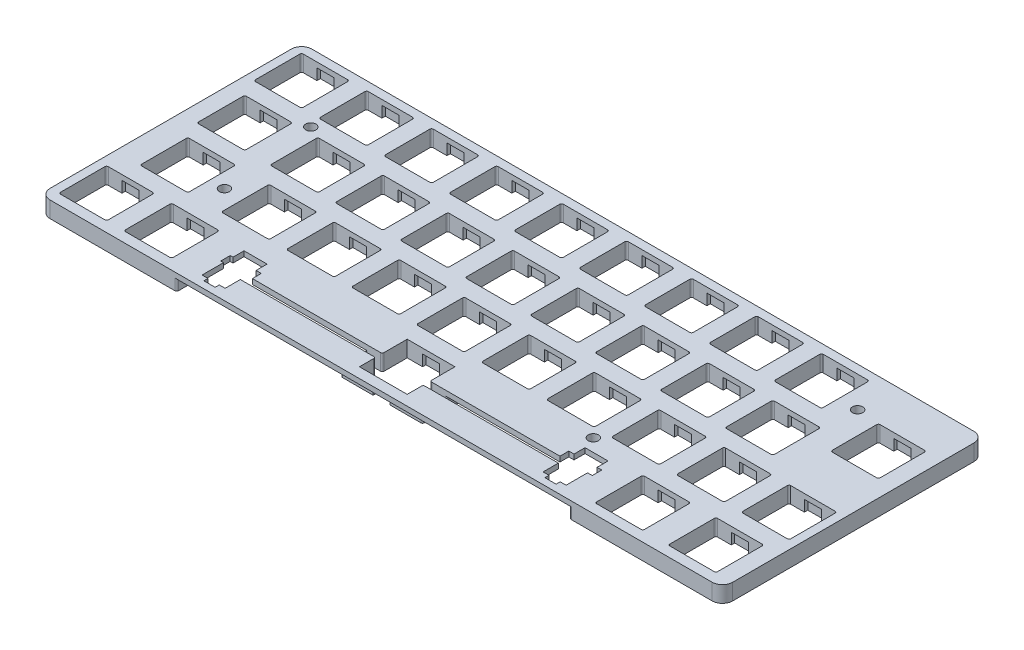
from build123d import *

# Parameters (mm, degrees)
SKETCH1_W           = 200.025
SKETCH1_H           = 76.675
BOSS_EXTRUDE1_DEPTH = 4.75
FILLET1_R           = 3
CUT_EXTRUDE1_DEPTH  = 3.25
FILLET2_R           = 0.5
CUT_EXTRUDE2_START  = -1.5
SKETCH5_W           = 5
SKETCH5_H           = 16
CUT_EXTRUDE2_DEPTH  = 3.25
SKETCH6_R           = 1.5
CUT_EXTRUDE3_DEPTH  = 211.847855396


with BuildPart() as part:
    # Sketch1 → Boss-Extrude1 (new body)
    with BuildSketch(Plane(origin=(0, 0, 0), x_dir=(1, 0, 0), z_dir=(0, 1, 0))):
        with Locations((97.4875, 35.3375)):
            Rectangle(SKETCH1_W, SKETCH1_H)
        with BuildLine():
            Line((13.5, 0), (0.5, 0))
            ThreePointArc((0.5, 0), (0.146446609, 0.146446609), (0, 0.5))
            Line((0, 0.5), (0, 13.5))
            ThreePointArc((0, 13.5), (0.146446609, 13.853553391), (0.5, 14))
            Line((0.5, 14), (13.5, 14))
            ThreePointArc((13.5, 14), (13.853553391, 13.853553391), (14, 13.5))
            Line((14, 13.5), (14, 0.5))
            ThreePointArc((14, 0.5), (13.853553391, 0.146446609), (13.5, 0))
        make_face(mode=Mode.SUBTRACT)
        with BuildLine():
            Line((32.55, 0), (19.55, 0))
            ThreePointArc((19.55, 0), (19.196446609, 0.146446609), (19.05, 0.5))
            Line((19.05, 0.5), (19.05, 13.5))
            ThreePointArc((19.05, 13.5), (19.196446609, 13.853553391), (19.55, 14))
            Line((19.55, 14), (32.55, 14))
            ThreePointArc((32.55, 14), (32.903553391, 13.853553391), (33.05, 13.5))
            Line((33.05, 13.5), (33.05, 0.5))
            ThreePointArc((33.05, 0.5), (32.903553391, 0.146446609), (32.55, 0))
        make_face(mode=Mode.SUBTRACT)
        Polygon((102.10625, 14), (102.10625, 6.7), (140.18125, 6.7), (140.18125, 9.3), (141.70625, 9.3), (141.70625, 12.53), (148.45625, 12.53), (148.45625, 9.3), (149.837752958, 9.3), (149.837752958, 6.515), (148.45625, 6.515), (148.45625, 0.23), (146.73125, 0.23), (146.73125, -0.97), (143.43125, -0.97), (143.43125, 0.23), (141.70625, 0.23), (141.70625, 4.7), (102.10625, 4.7), (102.10625, 0), (88.10625, 0), (88.10625, 4.7), (48.50625, 4.7), (48.50625, 0.23), (46.78125, 0.23), (46.78125, -0.97), (43.48125, -0.97), (43.48125, 0.23), (41.75625, 0.23), (41.75625, 6.515), (40.93125, 6.515), (40.93125, 9.3), (41.75625, 9.3), (41.75625, 12.53), (48.50625, 12.53), (48.50625, 9.3), (50.03125, 9.3), (50.03125, 6.7), (88.10625, 6.7), (88.10625, 14), align=None, mode=Mode.SUBTRACT)
        with BuildLine():
            Line((18.2625, 19.05), (5.2625, 19.05))
            ThreePointArc((5.2625, 19.05), (4.908946609, 19.196446609), (4.7625, 19.55))
            Line((4.7625, 19.55), (4.7625, 32.55))
            ThreePointArc((4.7625, 32.55), (4.908946609, 32.903553391), (5.2625, 33.05))
            Line((5.2625, 33.05), (18.2625, 33.05))
            ThreePointArc((18.2625, 33.05), (18.616053391, 32.903553391), (18.7625, 32.55))
            Line((18.7625, 32.55), (18.7625, 19.55))
            ThreePointArc((18.7625, 19.55), (18.616053391, 19.196446609), (18.2625, 19.05))
        make_face(mode=Mode.SUBTRACT)
        with BuildLine():
            Line((42.075, 19.05), (29.075, 19.05))
            ThreePointArc((29.075, 19.05), (28.721446609, 19.196446609), (28.575, 19.55))
            Line((28.575, 19.55), (28.575, 32.55))
            ThreePointArc((28.575, 32.55), (28.721446609, 32.903553391), (29.075, 33.05))
            Line((29.075, 33.05), (42.075, 33.05))
            ThreePointArc((42.075, 33.05), (42.428553391, 32.903553391), (42.575, 32.55))
            Line((42.575, 32.55), (42.575, 19.55))
            ThreePointArc((42.575, 19.55), (42.428553391, 19.196446609), (42.075, 19.05))
        make_face(mode=Mode.SUBTRACT)
        with BuildLine():
            Line((61.125, 19.05), (48.125, 19.05))
            ThreePointArc((48.125, 19.05), (47.771446609, 19.196446609), (47.625, 19.55))
            Line((47.625, 19.55), (47.625, 32.55))
            ThreePointArc((47.625, 32.55), (47.771446609, 32.903553391), (48.125, 33.05))
            Line((48.125, 33.05), (61.125, 33.05))
            ThreePointArc((61.125, 33.05), (61.478553391, 32.903553391), (61.625, 32.55))
            Line((61.625, 32.55), (61.625, 19.55))
            ThreePointArc((61.625, 19.55), (61.478553391, 19.196446609), (61.125, 19.05))
        make_face(mode=Mode.SUBTRACT)
        with BuildLine():
            Line((80.175, 19.05), (67.175, 19.05))
            ThreePointArc((67.175, 19.05), (66.821446609, 19.196446609), (66.675, 19.55))
            Line((66.675, 19.55), (66.675, 32.55))
            ThreePointArc((66.675, 32.55), (66.821446609, 32.903553391), (67.175, 33.05))
            Line((67.175, 33.05), (80.175, 33.05))
            ThreePointArc((80.175, 33.05), (80.528553391, 32.903553391), (80.675, 32.55))
            Line((80.675, 32.55), (80.675, 19.55))
            ThreePointArc((80.675, 19.55), (80.528553391, 19.196446609), (80.175, 19.05))
        make_face(mode=Mode.SUBTRACT)
        with BuildLine():
            Line((99.225, 19.05), (86.225, 19.05))
            ThreePointArc((86.225, 19.05), (85.871446609, 19.196446609), (85.725, 19.55))
            Line((85.725, 19.55), (85.725, 32.55))
            ThreePointArc((85.725, 32.55), (85.871446609, 32.903553391), (86.225, 33.05))
            Line((86.225, 33.05), (99.225, 33.05))
            ThreePointArc((99.225, 33.05), (99.578553391, 32.903553391), (99.725, 32.55))
            Line((99.725, 32.55), (99.725, 19.55))
            ThreePointArc((99.725, 19.55), (99.578553391, 19.196446609), (99.225, 19.05))
        make_face(mode=Mode.SUBTRACT)
        with BuildLine():
            Line((170.6625, 0), (157.6625, 0))
            ThreePointArc((157.6625, 0), (157.308946609, 0.146446609), (157.1625, 0.5))
            Line((157.1625, 0.5), (157.1625, 13.5))
            ThreePointArc((157.1625, 13.5), (157.308946609, 13.853553391), (157.6625, 14))
            Line((157.6625, 14), (170.6625, 14))
            ThreePointArc((170.6625, 14), (171.016053391, 13.853553391), (171.1625, 13.5))
            Line((171.1625, 13.5), (171.1625, 0.5))
            ThreePointArc((171.1625, 0.5), (171.016053391, 0.146446609), (170.6625, 0))
        make_face(mode=Mode.SUBTRACT)
        with BuildLine():
            Line((192.09375, 0), (179.09375, 0))
            ThreePointArc((179.09375, 0), (178.740196609, 0.146446609), (178.59375, 0.5))
            Line((178.59375, 0.5), (178.59375, 13.5))
            ThreePointArc((178.59375, 13.5), (178.740196609, 13.853553391), (179.09375, 14))
            Line((179.09375, 14), (192.09375, 14))
            ThreePointArc((192.09375, 14), (192.447303391, 13.853553391), (192.59375, 13.5))
            Line((192.59375, 13.5), (192.59375, 0.5))
            ThreePointArc((192.59375, 0.5), (192.447303391, 0.146446609), (192.09375, 0))
        make_face(mode=Mode.SUBTRACT)
        with BuildLine():
            Line((118.275, 19.05), (105.275, 19.05))
            ThreePointArc((105.275, 19.05), (104.921446609, 19.196446609), (104.775, 19.55))
            Line((104.775, 19.55), (104.775, 32.55))
            ThreePointArc((104.775, 32.55), (104.921446609, 32.903553391), (105.275, 33.05))
            Line((105.275, 33.05), (118.275, 33.05))
            ThreePointArc((118.275, 33.05), (118.628553391, 32.903553391), (118.775, 32.55))
            Line((118.775, 32.55), (118.775, 19.55))
            ThreePointArc((118.775, 19.55), (118.628553391, 19.196446609), (118.275, 19.05))
        make_face(mode=Mode.SUBTRACT)
        with BuildLine():
            Line((137.325, 19.05), (124.325, 19.05))
            ThreePointArc((124.325, 19.05), (123.971446609, 19.196446609), (123.825, 19.55))
            Line((123.825, 19.55), (123.825, 32.55))
            ThreePointArc((123.825, 32.55), (123.971446609, 32.903553391), (124.325, 33.05))
            Line((124.325, 33.05), (137.325, 33.05))
            ThreePointArc((137.325, 33.05), (137.678553391, 32.903553391), (137.825, 32.55))
            Line((137.825, 32.55), (137.825, 19.55))
            ThreePointArc((137.825, 19.55), (137.678553391, 19.196446609), (137.325, 19.05))
        make_face(mode=Mode.SUBTRACT)
        with BuildLine():
            Line((156.375, 19.05), (143.375, 19.05))
            ThreePointArc((143.375, 19.05), (143.021446609, 19.196446609), (142.875, 19.55))
            Line((142.875, 19.55), (142.875, 32.55))
            ThreePointArc((142.875, 32.55), (143.021446609, 32.903553391), (143.375, 33.05))
            Line((143.375, 33.05), (156.375, 33.05))
            ThreePointArc((156.375, 33.05), (156.728553391, 32.903553391), (156.875, 32.55))
            Line((156.875, 32.55), (156.875, 19.55))
            ThreePointArc((156.875, 19.55), (156.728553391, 19.196446609), (156.375, 19.05))
        make_face(mode=Mode.SUBTRACT)
        with BuildLine():
            Line((175.425, 19.05), (162.425, 19.05))
            ThreePointArc((162.425, 19.05), (162.071446609, 19.196446609), (161.925, 19.55))
            Line((161.925, 19.55), (161.925, 32.55))
            ThreePointArc((161.925, 32.55), (162.071446609, 32.903553391), (162.425, 33.05))
            Line((162.425, 33.05), (175.425, 33.05))
            ThreePointArc((175.425, 33.05), (175.778553391, 32.903553391), (175.925, 32.55))
            Line((175.925, 32.55), (175.925, 19.55))
            ThreePointArc((175.925, 19.55), (175.778553391, 19.196446609), (175.425, 19.05))
        make_face(mode=Mode.SUBTRACT)
        with BuildLine():
            Line((194.975, 32.55), (194.975, 19.55))
            ThreePointArc((194.975, 19.55), (194.828553391, 19.196446609), (194.475, 19.05))
            Line((194.475, 19.05), (181.475, 19.05))
            ThreePointArc((181.475, 19.05), (181.121446609, 19.196446609), (180.975, 19.55))
            Line((180.975, 19.55), (180.975, 32.55))
            ThreePointArc((180.975, 32.55), (181.121446609, 32.903553391), (181.475, 33.05))
            Line((181.475, 33.05), (194.475, 33.05))
            ThreePointArc((194.475, 33.05), (194.828553391, 32.903553391), (194.975, 32.55))
        make_face(mode=Mode.SUBTRACT)
        with BuildLine():
            Line((15.88125, 38.1), (2.88125, 38.1))
            ThreePointArc((2.88125, 38.1), (2.527696609, 38.246446609), (2.38125, 38.6))
            Line((2.38125, 38.6), (2.38125, 51.6))
            ThreePointArc((2.38125, 51.6), (2.527696609, 51.953553391), (2.88125, 52.1))
            Line((2.88125, 52.1), (15.88125, 52.1))
            ThreePointArc((15.88125, 52.1), (16.234803391, 51.953553391), (16.38125, 51.6))
            Line((16.38125, 51.6), (16.38125, 38.6))
            ThreePointArc((16.38125, 38.6), (16.234803391, 38.246446609), (15.88125, 38.1))
        make_face(mode=Mode.SUBTRACT)
        with BuildLine():
            Line((37.3125, 38.1), (24.3125, 38.1))
            ThreePointArc((24.3125, 38.1), (23.958946609, 38.246446609), (23.8125, 38.6))
            Line((23.8125, 38.6), (23.8125, 51.6))
            ThreePointArc((23.8125, 51.6), (23.958946609, 51.953553391), (24.3125, 52.1))
            Line((24.3125, 52.1), (37.3125, 52.1))
            ThreePointArc((37.3125, 52.1), (37.666053391, 51.953553391), (37.8125, 51.6))
            Line((37.8125, 51.6), (37.8125, 38.6))
            ThreePointArc((37.8125, 38.6), (37.666053391, 38.246446609), (37.3125, 38.1))
        make_face(mode=Mode.SUBTRACT)
        with BuildLine():
            Line((56.3625, 38.1), (43.3625, 38.1))
            ThreePointArc((43.3625, 38.1), (43.008946609, 38.246446609), (42.8625, 38.6))
            Line((42.8625, 38.6), (42.8625, 51.6))
            ThreePointArc((42.8625, 51.6), (43.008946609, 51.953553391), (43.3625, 52.1))
            Line((43.3625, 52.1), (56.3625, 52.1))
            ThreePointArc((56.3625, 52.1), (56.716053391, 51.953553391), (56.8625, 51.6))
            Line((56.8625, 51.6), (56.8625, 38.6))
            ThreePointArc((56.8625, 38.6), (56.716053391, 38.246446609), (56.3625, 38.1))
        make_face(mode=Mode.SUBTRACT)
        with BuildLine():
            Line((75.4125, 38.1), (62.4125, 38.1))
            ThreePointArc((62.4125, 38.1), (62.058946609, 38.246446609), (61.9125, 38.6))
            Line((61.9125, 38.6), (61.9125, 51.6))
            ThreePointArc((61.9125, 51.6), (62.058946609, 51.953553391), (62.4125, 52.1))
            Line((62.4125, 52.1), (75.4125, 52.1))
            ThreePointArc((75.4125, 52.1), (75.766053391, 51.953553391), (75.9125, 51.6))
            Line((75.9125, 51.6), (75.9125, 38.6))
            ThreePointArc((75.9125, 38.6), (75.766053391, 38.246446609), (75.4125, 38.1))
        make_face(mode=Mode.SUBTRACT)
        with BuildLine():
            Line((94.4625, 38.1), (81.4625, 38.1))
            ThreePointArc((81.4625, 38.1), (81.108946609, 38.246446609), (80.9625, 38.6))
            Line((80.9625, 38.6), (80.9625, 51.6))
            ThreePointArc((80.9625, 51.6), (81.108946609, 51.953553391), (81.4625, 52.1))
            Line((81.4625, 52.1), (94.4625, 52.1))
            ThreePointArc((94.4625, 52.1), (94.816053391, 51.953553391), (94.9625, 51.6))
            Line((94.9625, 51.6), (94.9625, 38.6))
            ThreePointArc((94.9625, 38.6), (94.816053391, 38.246446609), (94.4625, 38.1))
        make_face(mode=Mode.SUBTRACT)
        with BuildLine():
            Line((0.5, 71.15), (13.5, 71.15))
            ThreePointArc((13.5, 71.15), (13.853553391, 71.003553391), (14, 70.65))
            Line((14, 70.65), (14, 57.65))
            ThreePointArc((14, 57.65), (13.853553391, 57.296446609), (13.5, 57.15))
            Line((13.5, 57.15), (0.5, 57.15))
            ThreePointArc((0.5, 57.15), (0.146446609, 57.296446609), (0, 57.65))
            Line((0, 57.65), (0, 70.65))
            ThreePointArc((0, 70.65), (0.146446609, 71.003553391), (0.5, 71.15))
        make_face(mode=Mode.SUBTRACT)
        with BuildLine():
            Line((32.55, 57.15), (19.55, 57.15))
            ThreePointArc((19.55, 57.15), (19.196446609, 57.296446609), (19.05, 57.65))
            Line((19.05, 57.65), (19.05, 70.65))
            ThreePointArc((19.05, 70.65), (19.196446609, 71.003553391), (19.55, 71.15))
            Line((19.55, 71.15), (32.55, 71.15))
            ThreePointArc((32.55, 71.15), (32.903553391, 71.003553391), (33.05, 70.65))
            Line((33.05, 70.65), (33.05, 57.65))
            ThreePointArc((33.05, 57.65), (32.903553391, 57.296446609), (32.55, 57.15))
        make_face(mode=Mode.SUBTRACT)
        with BuildLine():
            Line((51.6, 57.15), (38.6, 57.15))
            ThreePointArc((38.6, 57.15), (38.246446609, 57.296446609), (38.1, 57.65))
            Line((38.1, 57.65), (38.1, 70.65))
            ThreePointArc((38.1, 70.65), (38.246446609, 71.003553391), (38.6, 71.15))
            Line((38.6, 71.15), (51.6, 71.15))
            ThreePointArc((51.6, 71.15), (51.953553391, 71.003553391), (52.1, 70.65))
            Line((52.1, 70.65), (52.1, 57.65))
            ThreePointArc((52.1, 57.65), (51.953553391, 57.296446609), (51.6, 57.15))
        make_face(mode=Mode.SUBTRACT)
        with BuildLine():
            Line((70.65, 57.15), (57.65, 57.15))
            ThreePointArc((57.65, 57.15), (57.296446609, 57.296446609), (57.15, 57.65))
            Line((57.15, 57.65), (57.15, 70.65))
            ThreePointArc((57.15, 70.65), (57.296446609, 71.003553391), (57.65, 71.15))
            Line((57.65, 71.15), (70.65, 71.15))
            ThreePointArc((70.65, 71.15), (71.003553391, 71.003553391), (71.15, 70.65))
            Line((71.15, 70.65), (71.15, 57.65))
            ThreePointArc((71.15, 57.65), (71.003553391, 57.296446609), (70.65, 57.15))
        make_face(mode=Mode.SUBTRACT)
        with BuildLine():
            Line((89.7, 57.15), (76.7, 57.15))
            ThreePointArc((76.7, 57.15), (76.346446609, 57.296446609), (76.2, 57.65))
            Line((76.2, 57.65), (76.2, 70.65))
            ThreePointArc((76.2, 70.65), (76.346446609, 71.003553391), (76.7, 71.15))
            Line((76.7, 71.15), (89.7, 71.15))
            ThreePointArc((89.7, 71.15), (90.053553391, 71.003553391), (90.2, 70.65))
            Line((90.2, 70.65), (90.2, 57.65))
            ThreePointArc((90.2, 57.65), (90.053553391, 57.296446609), (89.7, 57.15))
        make_face(mode=Mode.SUBTRACT)
        with BuildLine():
            Line((113.5125, 38.1), (100.5125, 38.1))
            ThreePointArc((100.5125, 38.1), (100.158946609, 38.246446609), (100.0125, 38.6))
            Line((100.0125, 38.6), (100.0125, 51.6))
            ThreePointArc((100.0125, 51.6), (100.158946609, 51.953553391), (100.5125, 52.1))
            Line((100.5125, 52.1), (113.5125, 52.1))
            ThreePointArc((113.5125, 52.1), (113.866053391, 51.953553391), (114.0125, 51.6))
            Line((114.0125, 51.6), (114.0125, 38.6))
            ThreePointArc((114.0125, 38.6), (113.866053391, 38.246446609), (113.5125, 38.1))
        make_face(mode=Mode.SUBTRACT)
        with BuildLine():
            Line((132.5625, 38.1), (119.5625, 38.1))
            ThreePointArc((119.5625, 38.1), (119.208946609, 38.246446609), (119.0625, 38.6))
            Line((119.0625, 38.6), (119.0625, 51.6))
            ThreePointArc((119.0625, 51.6), (119.208946609, 51.953553391), (119.5625, 52.1))
            Line((119.5625, 52.1), (132.5625, 52.1))
            ThreePointArc((132.5625, 52.1), (132.916053391, 51.953553391), (133.0625, 51.6))
            Line((133.0625, 51.6), (133.0625, 38.6))
            ThreePointArc((133.0625, 38.6), (132.916053391, 38.246446609), (132.5625, 38.1))
        make_face(mode=Mode.SUBTRACT)
        with BuildLine():
            Line((151.6125, 38.1), (138.6125, 38.1))
            ThreePointArc((138.6125, 38.1), (138.258946609, 38.246446609), (138.1125, 38.6))
            Line((138.1125, 38.6), (138.1125, 51.6))
            ThreePointArc((138.1125, 51.6), (138.258946609, 51.953553391), (138.6125, 52.1))
            Line((138.6125, 52.1), (151.6125, 52.1))
            ThreePointArc((151.6125, 52.1), (151.966053391, 51.953553391), (152.1125, 51.6))
            Line((152.1125, 51.6), (152.1125, 38.6))
            ThreePointArc((152.1125, 38.6), (151.966053391, 38.246446609), (151.6125, 38.1))
        make_face(mode=Mode.SUBTRACT)
        with BuildLine():
            Line((170.6625, 38.1), (157.6625, 38.1))
            ThreePointArc((157.6625, 38.1), (157.308946609, 38.246446609), (157.1625, 38.6))
            Line((157.1625, 38.6), (157.1625, 51.6))
            ThreePointArc((157.1625, 51.6), (157.308946609, 51.953553391), (157.6625, 52.1))
            Line((157.6625, 52.1), (170.6625, 52.1))
            ThreePointArc((170.6625, 52.1), (171.016053391, 51.953553391), (171.1625, 51.6))
            Line((171.1625, 51.6), (171.1625, 38.6))
            ThreePointArc((171.1625, 38.6), (171.016053391, 38.246446609), (170.6625, 38.1))
        make_face(mode=Mode.SUBTRACT)
        with BuildLine():
            Line((108.75, 57.15), (95.75, 57.15))
            ThreePointArc((95.75, 57.15), (95.396446609, 57.296446609), (95.25, 57.65))
            Line((95.25, 57.65), (95.25, 70.65))
            ThreePointArc((95.25, 70.65), (95.396446609, 71.003553391), (95.75, 71.15))
            Line((95.75, 71.15), (108.75, 71.15))
            ThreePointArc((108.75, 71.15), (109.103553391, 71.003553391), (109.25, 70.65))
            Line((109.25, 70.65), (109.25, 57.65))
            ThreePointArc((109.25, 57.65), (109.103553391, 57.296446609), (108.75, 57.15))
        make_face(mode=Mode.SUBTRACT)
        with BuildLine():
            Line((127.8, 57.15), (114.8, 57.15))
            ThreePointArc((114.8, 57.15), (114.446446609, 57.296446609), (114.3, 57.65))
            Line((114.3, 57.65), (114.3, 70.65))
            ThreePointArc((114.3, 70.65), (114.446446609, 71.003553391), (114.8, 71.15))
            Line((114.8, 71.15), (127.8, 71.15))
            ThreePointArc((127.8, 71.15), (128.153553391, 71.003553391), (128.3, 70.65))
            Line((128.3, 70.65), (128.3, 57.65))
            ThreePointArc((128.3, 57.65), (128.153553391, 57.296446609), (127.8, 57.15))
        make_face(mode=Mode.SUBTRACT)
        with BuildLine():
            Line((146.85, 57.15), (133.85, 57.15))
            ThreePointArc((133.85, 57.15), (133.496446609, 57.296446609), (133.35, 57.65))
            Line((133.35, 57.65), (133.35, 70.65))
            ThreePointArc((133.35, 70.65), (133.496446609, 71.003553391), (133.85, 71.15))
            Line((133.85, 71.15), (146.85, 71.15))
            ThreePointArc((146.85, 71.15), (147.203553391, 71.003553391), (147.35, 70.65))
            Line((147.35, 70.65), (147.35, 57.65))
            ThreePointArc((147.35, 57.65), (147.203553391, 57.296446609), (146.85, 57.15))
        make_face(mode=Mode.SUBTRACT)
        with BuildLine():
            Line((192.09375, 47.625), (179.09375, 47.625))
            ThreePointArc((179.09375, 47.625), (178.740196609, 47.771446609), (178.59375, 48.125))
            Line((178.59375, 48.125), (178.59375, 61.125))
            ThreePointArc((178.59375, 61.125), (178.740196609, 61.478553391), (179.09375, 61.625))
            Line((179.09375, 61.625), (192.09375, 61.625))
            ThreePointArc((192.09375, 61.625), (192.447303391, 61.478553391), (192.59375, 61.125))
            Line((192.59375, 61.125), (192.59375, 48.125))
            ThreePointArc((192.59375, 48.125), (192.447303391, 47.771446609), (192.09375, 47.625))
        make_face(mode=Mode.SUBTRACT)
        with BuildLine():
            Line((165.9, 57.15), (152.9, 57.15))
            ThreePointArc((152.9, 57.15), (152.546446609, 57.296446609), (152.4, 57.65))
            Line((152.4, 57.65), (152.4, 70.65))
            ThreePointArc((152.4, 70.65), (152.546446609, 71.003553391), (152.9, 71.15))
            Line((152.9, 71.15), (165.9, 71.15))
            ThreePointArc((165.9, 71.15), (166.253553391, 71.003553391), (166.4, 70.65))
            Line((166.4, 70.65), (166.4, 57.65))
            ThreePointArc((166.4, 57.65), (166.253553391, 57.296446609), (165.9, 57.15))
        make_face(mode=Mode.SUBTRACT)
    extrude(amount=BOSS_EXTRUDE1_DEPTH)

    # Fillet1
    fillet1_edges = [part.edges().sort_by_distance(p)[0] for p in [
        (-2.525, 2.375, 3),
        (197.5, 2.375, 3),
        (197.5, 2.375, -73.675),
        (-2.525, 2.375, -73.675),
    ]]
    fillet(fillet1_edges, radius=FILLET1_R)

    # Sketch4 → Cut-Extrude1 (cut)
    with BuildSketch(Plane.XZ):
        Polygon((37.55, 4.254574443), (37.55, -16), (83.10625, -16), (83.10625, 0.475), (107.10625, 0.475), (107.10625, -16), (152.6625, -16), (152.6625, 3), (192.59375, 3), (192.59375, 8.776016082), (0, 8.776016082), (0, 4.254574443), align=None)
    extrude(amount=-CUT_EXTRUDE1_DEPTH, mode=Mode.SUBTRACT)

    # Fillet2
    fillet2_edges = [part.edges().sort_by_distance(p)[0] for p in [
        (88.10625, 2.375, -4.7),
        (88.10625, 2.375, -6.7),
        (83.10625, 1.625, -6.7),
        (83.10625, 1.625, -4.7),
        (102.10625, 2.375, -4.7),
        (102.10625, 2.375, -6.7),
        (107.10625, 1.625, -6.7),
        (107.10625, 1.625, -4.7),
        (107.10625, 1.625, -16),
        (83.10625, 1.625, -16),
        (107.10625, 1.625, 0.475),
        (83.10625, 1.625, 0.475),
        (152.6625, 1.625, 3),
        (152.6625, 1.625, -16),
        (37.55, 1.625, 3),
        (37.55, 1.625, -16),
    ]]
    fillet(fillet2_edges, radius=FILLET2_R)

    # Sketch5 → Cut-Extrude2 (cut)
    with BuildSketch(Plane(origin=(0, 4.75, 0), x_dir=(1, 0, 0), z_dir=(0, 1, 0)).offset(CUT_EXTRUDE2_START)):
        with Locations((7, 64.15)):
            Rectangle(SKETCH5_W, SKETCH5_H)
        with Locations((26.05, 64.15)):
            Rectangle(SKETCH5_W, SKETCH5_H)
        with Locations((45.1, 64.15)):
            Rectangle(SKETCH5_W, SKETCH5_H)
        with Locations((64.15, 64.15)):
            Rectangle(SKETCH5_W, SKETCH5_H)
        with Locations((83.2, 64.15)):
            Rectangle(SKETCH5_W, SKETCH5_H)
        with Locations((102.25, 64.15)):
            Rectangle(SKETCH5_W, SKETCH5_H)
        with Locations((121.3, 64.15)):
            Rectangle(SKETCH5_W, SKETCH5_H)
        with Locations((140.35, 64.15)):
            Rectangle(SKETCH5_W, SKETCH5_H)
        with Locations((159.4, 64.15)):
            Rectangle(SKETCH5_W, SKETCH5_H)
        with Locations((30.8125, 45.1)):
            Rectangle(SKETCH5_W, SKETCH5_H)
        with Locations((49.8625, 45.1)):
            Rectangle(SKETCH5_W, SKETCH5_H)
        with Locations((68.9125, 45.1)):
            Rectangle(SKETCH5_W, SKETCH5_H)
        with Locations((87.9625, 45.1)):
            Rectangle(SKETCH5_W, SKETCH5_H)
        with Locations((107.0125, 45.1)):
            Rectangle(SKETCH5_W, SKETCH5_H)
        with Locations((126.0625, 45.1)):
            Rectangle(SKETCH5_W, SKETCH5_H)
        with Locations((145.1125, 45.1)):
            Rectangle(SKETCH5_W, SKETCH5_H)
        with Locations((164.1625, 45.1)):
            Rectangle(SKETCH5_W, SKETCH5_H)
        with Locations((35.575, 26.05)):
            Rectangle(SKETCH5_W, SKETCH5_H)
        with Locations((54.625, 26.05)):
            Rectangle(SKETCH5_W, SKETCH5_H)
        with Locations((73.675, 26.05)):
            Rectangle(SKETCH5_W, SKETCH5_H)
        with Locations((92.725, 26.05)):
            Rectangle(SKETCH5_W, SKETCH5_H)
        with Locations((111.775, 26.05)):
            Rectangle(SKETCH5_W, SKETCH5_H)
        with Locations((130.825, 26.05)):
            Rectangle(SKETCH5_W, SKETCH5_H)
        with Locations((149.875, 26.05)):
            Rectangle(SKETCH5_W, SKETCH5_H)
        with Locations((168.925, 26.05)):
            Rectangle(SKETCH5_W, SKETCH5_H)
        with Locations((187.975, 26.05)):
            Rectangle(SKETCH5_W, SKETCH5_H)
        with Locations((9.38125, 45.1)):
            Rectangle(SKETCH5_W, SKETCH5_H)
        with Locations((11.7625, 26.05)):
            Rectangle(SKETCH5_W, SKETCH5_H)
        with Locations((185.59375, 54.625)):
            Rectangle(SKETCH5_W, SKETCH5_H)
        with Locations((7, 7)):
            Rectangle(SKETCH5_W, SKETCH5_H)
        with Locations((26.05, 7)):
            Rectangle(SKETCH5_W, SKETCH5_H)
        with Locations((164.1625, 7)):
            Rectangle(SKETCH5_W, SKETCH5_H)
        with Locations((185.59375, 7)):
            Rectangle(SKETCH5_W, SKETCH5_H)
        with Locations((95.10625, 7)):
            Rectangle(SKETCH5_W, SKETCH5_H)
    extrude(amount=-CUT_EXTRUDE2_DEPTH, mode=Mode.SUBTRACT)

    # Sketch6 → Cut-Extrude3 (cut, through all)
    with BuildSketch(Plane(origin=(0, 4.75, 0), x_dir=(1, 0, 0), z_dir=(0, 1, 0))):
        with Locations((23.115321192, 25.428926284)):
            Circle(SKETCH6_R)
        with Locations((172.021854618, 62.09158438)):
            Circle(SKETCH6_R)
        with Locations((20.115321192, 53.743827003)):
            Circle(SKETCH6_R)
        with Locations((140.399263367, 16.249417168)):
            Circle(SKETCH6_R)
    extrude(amount=-CUT_EXTRUDE3_DEPTH, mode=Mode.SUBTRACT)


solid = part.part
